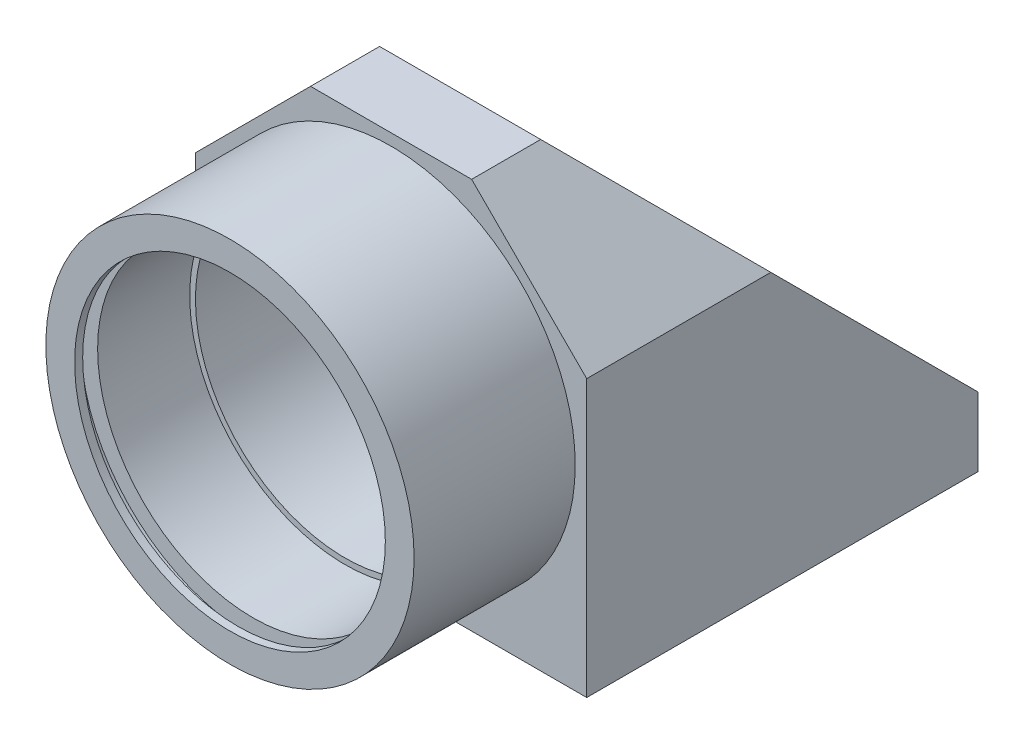
from build123d import *

# Parameters (mm, degrees)
SKETCH_1_W             = 34
SKETCH_1_H             = 34
SKETCH_1_R             = 13
EXTRUDE_1_DEPTH        = 48
SKETCH_2_R             = 13.5
CUT_EXTRUDE_1_DEPTH    = 10
SKETCH_3_R             = 13
CUT_EXTRUDE_2_DEPTH    = 10
CHAMFER_1_SIZE         = 10
CHAMFER_2_SIZE         = 28
SKETCH_5_R             = 16
CUT_EXTRUDE_4_DEPTH    = 14
HOLE_WIZARD_M4_1_D     = 3.3
HOLE_WIZARD_M4_1_DEPTH = 8
HOLE_WIZARD_M4_1_TIP   = 0.991420021
SKETCH_8_W             = 1.3
SKETCH_8_H             = 1.5


with BuildPart() as part:
    # 草图1 → 凸台-拉伸1 (new body)
    with BuildSketch(Plane.XY):
        Rectangle(SKETCH_1_W, SKETCH_1_H)
        Circle(SKETCH_1_R, mode=Mode.SUBTRACT)
    extrude(amount=EXTRUDE_1_DEPTH)

    # 草图2 → 切除-拉伸1 (cut)
    with BuildSketch(Plane.XY.offset(48)):
        Circle(SKETCH_2_R)
    extrude(amount=-CUT_EXTRUDE_1_DEPTH, mode=Mode.SUBTRACT)

    # 草图3 → 切除-拉伸2 (cut)
    with BuildSketch(Plane.XZ.offset(17)):
        with Locations(Location((0, 17, 0), (0, 0, 270))):
            Circle(SKETCH_3_R)
    extrude(amount=-CUT_EXTRUDE_2_DEPTH, mode=Mode.SUBTRACT)

    # 倒角1
    chamfer_1_edges = [part.edges().sort_by_distance(p)[0] for p in [
        (-17, 17, 24),
        (17, 17, 24),
    ]]
    chamfer(chamfer_1_edges, length=CHAMFER_1_SIZE)

    # 倒角2
    # the kernel refuses this chamfer: 28 mm, written as the material it takes off along each edge
    with BuildSketch(Plane(origin=(79.007123663, 17, 0), x_dir=(0, -0.9996219169112968, -0.027495876610586376), z_dir=(-1, 0, 0))) as chamfer_2_piece_1:
        Polygon((CHAMFER_2_SIZE * 0.999621916911, CHAMFER_2_SIZE * 0.0274958766106), (-CHAMFER_2_SIZE * 0.0274958766106, CHAMFER_2_SIZE * 0.999621916911), (0, 0), align=None)
    extrude(amount=158.014247326, mode=Mode.SUBTRACT)

    # 草图5 → 切除-拉伸4 (cut)
    with BuildSketch(Plane.XY.offset(48)):
        Polygon((-7, 17), (-17, 7), (-17, -17), (17, -17), (17, 7), (7, 17), align=None)
        Circle(SKETCH_5_R, mode=Mode.SUBTRACT)
    extrude(amount=-CUT_EXTRUDE_4_DEPTH, mode=Mode.SUBTRACT)

    # M4 螺纹孔1
    with Locations(Plane.XZ.offset(17)):
        with Locations((13, 30), (13, 4), (-13, 4), (-13, 30)):
            Hole(HOLE_WIZARD_M4_1_D / 2, depth=HOLE_WIZARD_M4_1_DEPTH)
            with Locations((0, 0, -(HOLE_WIZARD_M4_1_DEPTH + HOLE_WIZARD_M4_1_TIP / 2))):  # 118° drill point
                Cone(0, HOLE_WIZARD_M4_1_D / 2, HOLE_WIZARD_M4_1_TIP, mode=Mode.SUBTRACT)

    # 草图8 → 切除-旋转1 (revolve, cut)
    with BuildSketch(Plane(origin=(0, 0, 0), x_dir=(0, 0, -1), z_dir=(1, 0, 0)), mode=Mode.PRIVATE) as cut_revolve_1_sk:
        with Locations((-46.65, 14.25)):
            Rectangle(SKETCH_8_W, SKETCH_8_H)
    revolve(cut_revolve_1_sk.sketch.rotate(Axis((0, 0, 0), (0, 0, 1)), 147.795772496), axis=Axis((0, 0, 0), (0, 0, 1)), mode=Mode.SUBTRACT)


solid = part.part
